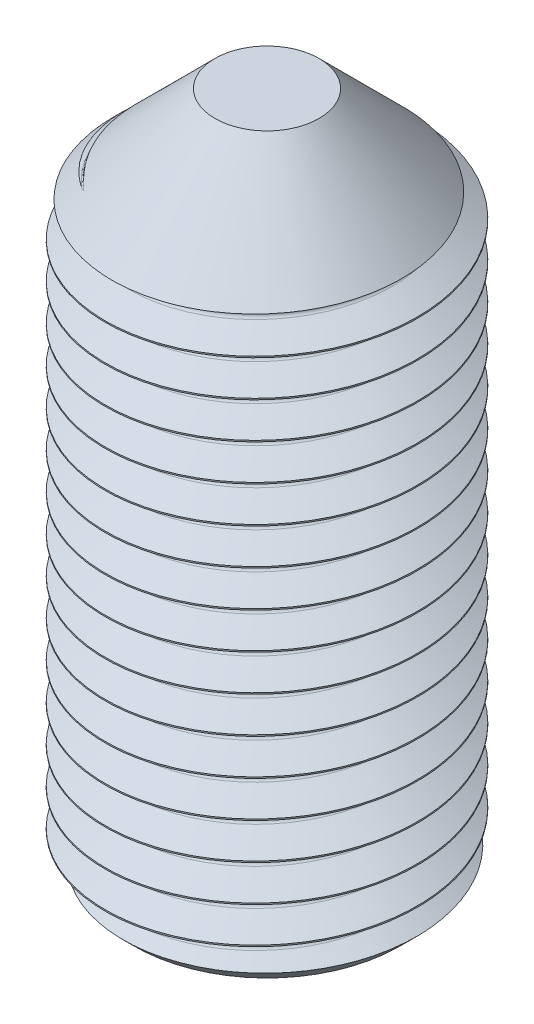
from build123d import *

# Parameters (mm, degrees)
SKETCH1_R           = 15
BOSS_EXTRUDE1_DEPTH = 32.5
CUT_EXTRUDE1_DEPTH  = 16
CUT_SWEEP1_PITCH    = 3.5
SKETCH6_R           = 8.198373822
CUT_EXTRUDE2_DEPTH  = 1.5
CUT_EXTRUDE2_DRAFT  = -75


with BuildPart() as part:
    # Sketch1 → Boss-Extrude1 (new, symmetric)
    with BuildSketch(Plane(origin=(0, 0, 0), x_dir=(1, 0, 0), z_dir=(0, 1, 0))):
        with Locations(Location((0, 0, 0), (0, 0, 270))):
            Circle(SKETCH1_R)
    extrude(amount=BOSS_EXTRUDE1_DEPTH, both=True)

    # Sketch2 → Cut-Revolve1 (revolve, cut)
    with BuildSketch(Plane.XY, mode=Mode.PRIVATE) as cut_revolve1_sk:
        Polygon((5, 32.5), (29.35821077, 8.14178923), (29.35821077, -15.89178923), (12.75, -32.5), (12.75, -71.534943227), (75.112424638, -71.534943227), (75.112424638, 77.775247807), (5, 77.775247807), align=None)
    revolve(cut_revolve1_sk.sketch.rotate(Axis((0, 0, 0), (0, -1, 0)), 270), axis=Axis((0, 0, 0), (0, -1, 0)), mode=Mode.SUBTRACT)

    # Sketch3 → Cut-Extrude1 (cut)
    with BuildSketch(Plane.XZ.offset(32.5)):
        Polygon((7.1, -4.099186911), (7.1, 4.099186911), (0, 8.198373822), (-7.1, 4.099186911), (-7.1, -4.099186911), (0, -8.198373822), align=None)
    extrude(amount=-CUT_EXTRUDE1_DEPTH, mode=Mode.SUBTRACT)

    # Cut-Sweep1: arcs per turn and ends read off the stored shape
    # Cut-Sweep1: the profile of Sketch5 screwed along a right-hand helix through 21 turns, 12 arcs to a turn; built about Z, then put on its axis
    cut_sweep1_z = Axis((0, 0, 0), (0, 0, 1))
    cut_sweep1_corners = [(15.102091829, 2.3722e-05, -0.542485199), (12.62078817, 1.9825e-05, -1.975066534), (12.44041317, 1.9541e-05, -2.287485199), (12.62078817, 1.9825e-05, -2.599903863), (15.102091829, 2.3722e-05, -4.032485199)]
    with BuildLine(mode=Mode.PRIVATE) as cut_sweep1_profile:
        Line(cut_sweep1_corners[0], cut_sweep1_corners[1])
        Line(cut_sweep1_corners[3], cut_sweep1_corners[4])
        Line(cut_sweep1_corners[4], cut_sweep1_corners[0])
        ThreePointArc((12.62078817, 1.9825e-05, -1.975066534), (12.488744505, 1.9617e-05, -2.107110199), (12.44041317, 1.9541e-05, -2.287485199))
        ThreePointArc((12.44041317, 1.9541e-05, -2.287485199), (12.488744505, 1.9617e-05, -2.467860199), (12.62078817, 1.9825e-05, -2.599903863))
    cut_sweep1_cap = Face(cut_sweep1_profile.wire())
    cut_sweep1_arcs = [((12.62078817, 1.9825e-05, -1.975066534), (12.44041317, 1.9541e-05, -2.079206089), (12.44041317, 1.9541e-05, -2.287485199), (1, 0.86602540378444, 1)), ((12.44041317, 1.9541e-05, -2.287485199), (12.44041317, 1.9541e-05, -2.495764308), (12.62078817, 1.9825e-05, -2.599903863), (1, 0.86602540378444, 1))]  # start, shoulder, end, weights
    cut_sweep1_turn_angles = [0, 15, 30, 45, 60, 75, 90, 105, 120, 135, 150, 165, 180, 195, 210, 225, 240, 255, 270, 285, 300, 315, 330, 345, 360]
    cut_sweep1_turn_weights = [1, 0.9659258262890683, 1, 0.9659258262890683, 1, 0.9659258262890683, 1, 0.9659258262890683, 1, 0.9659258262890683, 1, 0.9659258262890683, 1, 0.9659258262890683, 1, 0.9659258262890683, 1, 0.9659258262890683, 1, 0.9659258262890683, 1, 0.9659258262890683, 1, 0.9659258262890683, 1]
    cut_sweep1_turn_rails = [Edge.make_bspline([Vector(p[0], p[1], 0).rotate(cut_sweep1_z, cut_sweep1_turn_angles[k]) / cut_sweep1_turn_weights[k] + Vector(0, 0, p[2] + CUT_SWEEP1_PITCH * cut_sweep1_turn_angles[k] / 360) for k in range(25)], [0, 0, 0, 1, 1, 2, 2, 3, 3, 4, 4, 5, 5, 6, 6, 7, 7, 8, 8, 9, 9, 10, 10, 11, 11, 12, 12, 12], 2, cut_sweep1_turn_weights) for p in cut_sweep1_corners]
    cut_sweep1_turn_sides = [*[Face.make_surface_from_curves(cut_sweep1_turn_rails[p[0]], cut_sweep1_turn_rails[p[1]]) for p in [(0, 1), (3, 4), (4, 0)]], *[Face.make_bezier_surface([[Vector(p[j][0], p[j][1], 0).rotate(cut_sweep1_z, cut_sweep1_turn_angles[2 * i + k]) / cut_sweep1_turn_weights[2 * i + k] + Vector(0, 0, p[j][2] + CUT_SWEEP1_PITCH * cut_sweep1_turn_angles[2 * i + k] / 360) for k in range(3)] for j in range(3)], [[p[3][j] * cut_sweep1_turn_weights[2 * i + k] for k in range(3)] for j in range(3)]) for p in cut_sweep1_arcs for i in range(12)]]
    cut_sweep1 = Plane(origin=(0, -32.5, 0), x_dir=(-1, 0, 0), z_dir=(0, 1, 0)) * Solid(Shell([*[p.moved(Location((0, 0, CUT_SWEEP1_PITCH * i))) for i in range(21) for p in cut_sweep1_turn_sides], cut_sweep1_cap, cut_sweep1_cap.rotate(cut_sweep1_z, 7560).moved(Location((0, 0, CUT_SWEEP1_PITCH * 7560 / 360)))]))
    add(cut_sweep1, mode=Mode.SUBTRACT)


with BuildPart() as cut_extrude2_tool:
    # Sketch6 → Cut-Extrude2 (with draft: the straight prism first)
    with BuildSketch(Plane.XZ.offset(32.5)):
        Circle(SKETCH6_R)
    extrude(amount=-CUT_EXTRUDE2_DEPTH)
    # Cut-Extrude2: the draft: its side faces are tilted about the plane it starts from
    cut_extrude2_sides = [cut_extrude2_tool.faces().sort_by_distance(p)[0] for p in [
        (-8.198373822, -31.75, 0),
    ]]
    draft(cut_extrude2_sides, Plane.XZ.offset(32.5), CUT_EXTRUDE2_DRAFT)


with BuildPart() as part_1:
    add(part.part)

    # Cut-Extrude2: cut by cut_extrude2_tool
    add(cut_extrude2_tool.part, mode=Mode.SUBTRACT)


solid = part_1.part
